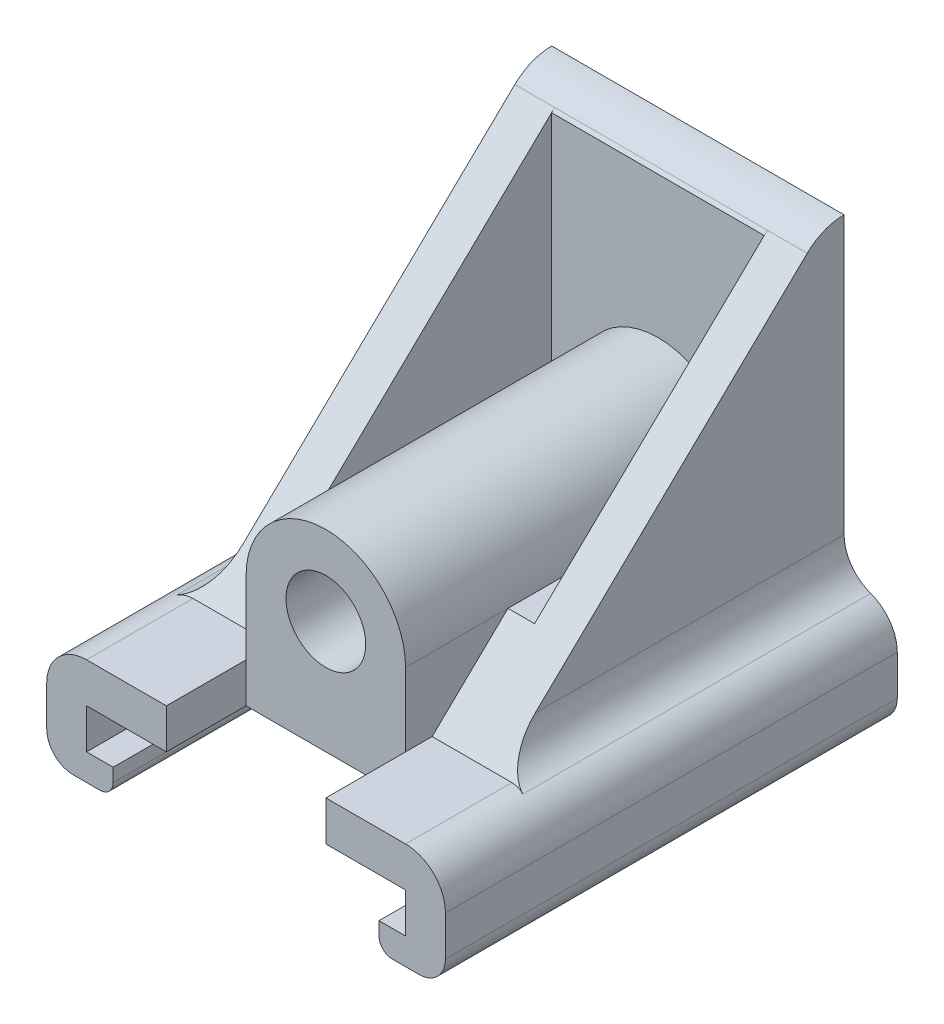
from build123d import *

# Parameters (mm, degrees)
BOSS_EXTRUDE1_DEPTH   = 107.95
BOSS_EXTRUDE1_2_DEPTH = 107.95
SKETCH1_6_W           = 6.35
SKETCH1_6_H           = 17.4625
BOSS_EXTRUDE2_DEPTH   = 82.55
CUT_EXTRUDE2_REACH    = 157.031
BOSS_EXTRUDE4_DEPTH   = 88.9
BOSS_EXTRUDE6_REACH   = 152.176
SKETCH5_R             = 9.525
CUT_EXTRUDE3_DEPTH    = 31.75
FILLET2_R             = 9.525


with BuildPart() as part:
    # Sketch1 → Boss-Extrude1 (new body)
    with BuildSketch(Plane.XY):
        with BuildLine():
            ThreePointArc((34.925, -25.4), (32.67993597, -24.47006403), (31.75, -22.225))
            Line((31.75, -22.225), (31.75, -19.05))
            Line((31.75, -19.05), (38.1, -19.05))
            Line((38.1, -19.05), (38.1, -9.525))
            Line((38.1, -9.525), (19.05, -9.525))
            Line((19.05, -9.525), (19.05, 0))
            Line((19.05, 0), (38.1, 0))
            ThreePointArc((38.1, 0), (44.835192091, -2.789807909), (47.625, -9.525))
            Line((47.625, -9.525), (47.625, -19.05))
            ThreePointArc((47.625, -19.05), (45.765128061, -23.540128061), (41.275, -25.4))
            Line((41.275, -25.4), (34.925, -25.4))
        make_face()
    extrude(amount=BOSS_EXTRUDE1_DEPTH)

    # Sketch1<6> → Boss-Extrude2 (add)
    with BuildSketch(Plane.XY):
        with Locations((22.225, 8.73125)):
            Rectangle(SKETCH1_6_W, SKETCH1_6_H)
        Polygon((25.4, 17.4625), (25.4, 0), (34.925, 0), (34.925, 74.6125), (25.4, 74.6125), align=None)
    boss_extrude2 = extrude(amount=BOSS_EXTRUDE2_DEPTH)

    # Cut-Extrude2: up to this face of the body (flat: up to its plane)
    cut_extrude2_end = Plane(part.part.faces().sort_by_distance((19.05, 3.113443878, 46.562346939))[0])
    # Sketch3 → Cut-Extrude2 (cut, up to the picked face)
    with BuildSketch(Plane(origin=(34.925, 0, 0), x_dir=(0, 0, -1), z_dir=(1, 0, 0)), mode=Mode.PRIVATE) as cut_extrude2_sk1:
        with BuildLine():
            Line((-82.55, 0), (-8.812527697, 71.057408725))
            ThreePointArc((-8.812527697, 71.057408725), (-4.751297675, 73.690240462), (0, 74.6125))
            Line((0, 74.6125), (-82.55, 74.6125))
            Line((-82.55, 74.6125), (-82.55, 0))
        make_face()
    cut_extrude2_tool1 = split(extrude(cut_extrude2_sk1.sketch, amount=-CUT_EXTRUDE2_REACH, mode=Mode.PRIVATE), bisect_by=cut_extrude2_end, keep=Keep.BOTH, mode=Mode.PRIVATE)
    cut_extrude2 = cut_extrude2_tool1.solids().sort_by(Axis((34.925, 49.768554, 56.6833), (-1, 0, 0)))[0]
    add(cut_extrude2, mode=Mode.SUBTRACT)



with BuildPart() as body_2:
    # Sketch1 → Boss-Extrude1 2 (new body)
    with BuildSketch(Plane.XY):
        with BuildLine():
            Line((-38.1, -9.525), (-19.05, -9.525))
            Line((-19.05, -9.525), (-19.05, 0))
            Line((-19.05, 0), (-25.4, 0))
            Line((-25.4, 0), (-34.925, 0))
            Line((-34.925, 0), (-38.1, 0))
            ThreePointArc((-38.1, 0), (-44.835192091, -2.789807909), (-47.625, -9.525))
            Line((-47.625, -9.525), (-47.625, -19.05))
            ThreePointArc((-47.625, -19.05), (-45.765128061, -23.540128061), (-41.275, -25.4))
            Line((-41.275, -25.4), (-34.925, -25.4))
            ThreePointArc((-34.925, -25.4), (-32.67993597, -24.47006403), (-31.75, -22.225))
            Line((-31.75, -22.225), (-31.75, -19.05))
            Line((-31.75, -19.05), (-38.1, -19.05))
            Line((-38.1, -19.05), (-38.1, -9.525))
        make_face()
    extrude(amount=BOSS_EXTRUDE1_2_DEPTH)


with BuildPart() as part_1:
    add(part.part)

    add(body_2.part)  # Boss-Extrude4 merges body 2
    # Sketch1<8> → Boss-Extrude4 (add)
    with BuildSketch(Plane.XY):
        with BuildLine():
            Line((19.05, -9.525), (19.05, 0))
            Line((19.05, 0), (19.05, 17.4625))
            ThreePointArc((19.05, 17.4625), (0, 36.5125), (-19.05, 17.4625))
            Line((-19.05, 17.4625), (-19.05, 0))
            Line((-19.05, 0), (-19.05, -9.525))
            Line((-19.05, -9.525), (19.05, -9.525))
        make_face()
    extrude(amount=BOSS_EXTRUDE4_DEPTH)

    # Mirror1: Boss-Extrude2, Cut-Extrude2 across plane
    add(boss_extrude2.mirror(Plane(origin=(0, 0, 0), x_dir=(0, 0, 1), z_dir=(1, 0, 0))))
    add(cut_extrude2.mirror(Plane(origin=(0, 0, 0), x_dir=(0, 0, 1), z_dir=(1, 0, 0))), mode=Mode.SUBTRACT)

    # Boss-Extrude6: up to this face of the body (flat: up to its plane)
    boss_extrude6_end = Plane(part_1.part.faces().sort_by_distance((25.4, 37.857380573, 21.629312561))[0])
    # Sketch4 → Boss-Extrude6 (add, up to the picked face)
    with BuildSketch(Plane(origin=(-25.4, 0, 0), x_dir=(0, 0, -1), z_dir=(1, 0, 0)), mode=Mode.PRIVATE) as boss_extrude6_sk1:
        with BuildLine():
            Line((0, 17.4625), (0, 74.6125))
            ThreePointArc((0, 74.6125), (-4.751297675, 73.690240462), (-8.812527697, 71.057408725))
            Line((-8.812527697, 71.057408725), (-9.525, 70.312760413))
            Line((-9.525, 70.312760413), (-9.525, 17.4625))
            Line((-9.525, 17.4625), (0, 17.4625))
        make_face()
    boss_extrude6_tool1 = split(extrude(boss_extrude6_sk1.sketch, amount=BOSS_EXTRUDE6_REACH, mode=Mode.PRIVATE), bisect_by=boss_extrude6_end, keep=Keep.BOTH, mode=Mode.PRIVATE)
    add(boss_extrude6_tool1.solids().sort_by(Axis((-25.4, 45.391099, 4.704073), (1, 0, 0)))[0])

    # Sketch5 → Cut-Extrude3 (cut)
    with BuildSketch(Plane.XY.offset(88.9)):
        with Locations((0, 17.4625)):
            Circle(SKETCH5_R)
    extrude(amount=-CUT_EXTRUDE3_DEPTH, mode=Mode.SUBTRACT)

    # Fillet2
    # the kernel refuses this fillet: 9.525 mm, written as the material it adds along each edge
    with BuildSketch(Plane(origin=(-34.925, 0, 0), x_dir=(-0.9963405296085165, -0.08547250469841781, 0), z_dir=(0, 0, 1))) as fillet2_piece_1_section:
        with BuildLine():
            CenterArc((8.769139185, -9.218768342), FILLET2_R, 104.568024357, 70.528779366)
            Line((-0.72100436, -8.404642735), (-1.670018714, -8.323230174))
            Line((-1.670018714, -8.323230174), (-0.949014354, 0.081412561))
            Line((-0.949014354, 0.081412561), (0.081412561, 0.949014354))
            ThreePointArc((0.081412561, 0.949014354), (3.244793742, 0.677639152), (6.133741367, 0.921876834))
            Line((6.133741367, 0.921876834), (6.373322987, 0))
        make_face()
    fillet2_piece_1 = extrude(amount=103.638780605, mode=Mode.PRIVATE)
    fillet2_piece_1 = split(fillet2_piece_1, bisect_by=Plane(origin=(-36.202557182, 22.072398362, 59.645099694), z_dir=(0, -0.7200715531259144, -0.6938998186905898)), keep=Keep.TOP, mode=Mode.PRIVATE)
    add(fillet2_piece_1)
    with BuildSketch(Plane(origin=(34.925, 0, 0), x_dir=(0, 1, 0), z_dir=(0, 0, 1))) as fillet2_piece_2_section:
        with BuildLine():
            CenterArc((8.435512242, -9.525), FILLET2_R, 90, 70.528779366)
            Line((-0.544743879, -6.35), (-1.442769491, -6.0325))
            ThreePointArc((-1.442769491, -6.0325), (-0.9525, -3.175), (-0.9525, 0))
            Line((-0.9525, 0), (0, 0.9525))
            Line((0, 0.9525), (8.435512242, 0.9525))
            Line((8.435512242, 0.9525), (8.435512242, 0))
        make_face()
    fillet2_piece_2 = extrude(amount=103.638780605, mode=Mode.PRIVATE)
    fillet2_piece_2 = split(fillet2_piece_2, bisect_by=Plane(origin=(36.202557182, 22.072398362, 59.645099694), z_dir=(0, -0.7200715531259144, -0.6938998186905898)), keep=Keep.TOP, mode=Mode.PRIVATE)
    add(fillet2_piece_2)


solid = part_1.part
